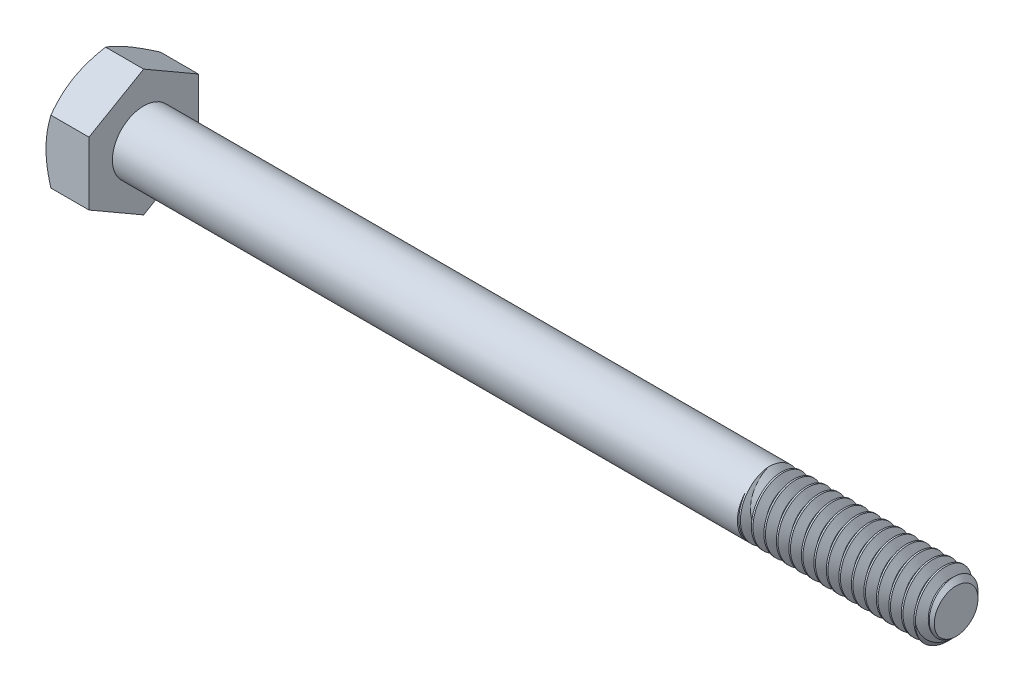
from build123d import *

# Parameters (mm, degrees)
SKETCH5_R           = 3.175
BOSS_EXTRUDE3_DEPTH = 82.55
CHAMFER1_SIZE       = 0.9525
CUT_SWEEP1_PITCH    = 1.27
BOSS_EXTRUDE4_DEPTH = 4.365625
SKETCH8_OUTSIDE_W   = 336.804
SKETCH8_OUTSIDE_H   = 338.524
SKETCH8_OUTSIDE_R   = 5.55625
CUT_EXTRUDE3_DEPTH  = 88.329034992
CUT_EXTRUDE3_DRAFT  = -60
CUT_EXTRUDE4_DEPTH  = 0.254
CIRPATTERN1_COUNT   = 3


with BuildPart() as part:
    # Sketch5 → Boss-Extrude3 (new body)
    with BuildSketch(Plane(origin=(43.4578125, 0, 0), x_dir=(0, 0, -1), z_dir=(1, 0, 0))):
        Circle(SKETCH5_R)
    extrude(amount=-BOSS_EXTRUDE3_DEPTH)

    # Chamfer1
    chamfer1_edges = [part.edges().sort_by_distance(p)[0] for p in [
        (43.4578125, 0, 3.175),
    ]]
    chamfer(chamfer1_edges, length=CHAMFER1_SIZE)

    # Cut-Sweep1: the profile of Sketch10 profile screwed along a right-hand helix of 16 turns, 8 arcs to a turn; built about Z, then put on its axis
    cut_sweep1_z = Axis((0, 0, 0), (0, 0, 1))
    cut_sweep1_corners = [(3.1753, 0, 0.000173205), (2.350110803, 0, -0.47625), (2.350110803, 0, -0.635), (3.1753, 0, -1.111423205)]
    with BuildLine(mode=Mode.PRIVATE) as cut_sweep1_profile:
        Line(cut_sweep1_corners[0], cut_sweep1_corners[1])
        Line(cut_sweep1_corners[1], cut_sweep1_corners[2])
        Line(cut_sweep1_corners[2], cut_sweep1_corners[3])
        Line(cut_sweep1_corners[3], cut_sweep1_corners[0])
    cut_sweep1_cap = Face(cut_sweep1_profile.wire())
    cut_sweep1_turn_angles = [0, 22.5, 45, 67.5, 90, 112.5, 135, 157.5, 180, 202.5, 225, 247.5, 270, 292.5, 315, 337.5, 360]
    cut_sweep1_turn_weights = [1, 0.9238795325112867, 1, 0.9238795325112867, 1, 0.9238795325112867, 1, 0.9238795325112867, 1, 0.9238795325112867, 1, 0.9238795325112867, 1, 0.9238795325112867, 1, 0.9238795325112867, 1]
    cut_sweep1_turn_rails = [Edge.make_bspline([Vector(p[0], p[1], 0).rotate(cut_sweep1_z, cut_sweep1_turn_angles[k]) / cut_sweep1_turn_weights[k] + Vector(0, 0, p[2] + CUT_SWEEP1_PITCH * cut_sweep1_turn_angles[k] / 360) for k in range(17)], [0, 0, 0, 1, 1, 2, 2, 3, 3, 4, 4, 5, 5, 6, 6, 7, 7, 8, 8, 8], 2, cut_sweep1_turn_weights) for p in cut_sweep1_corners]
    cut_sweep1_turn_sides = [Face.make_surface_from_curves(cut_sweep1_turn_rails[p[0]], cut_sweep1_turn_rails[p[1]]) for p in [(0, 1), (1, 2), (2, 3), (3, 0)]]
    cut_sweep1 = Plane(origin=(43.4578125, 0, 0), x_dir=(0, 1, 0), z_dir=(-1, 0, 0)) * Solid(Shell([*[p.moved(Location((0, 0, CUT_SWEEP1_PITCH * i))) for i in range(16) for p in cut_sweep1_turn_sides], cut_sweep1_cap, cut_sweep1_cap.rotate(cut_sweep1_z, 5760).moved(Location((0, 0, CUT_SWEEP1_PITCH * 5760 / 360)))]))
    add(cut_sweep1, mode=Mode.SUBTRACT)

    # Sketch11 → Revolve1 (revolve)
    with BuildSketch(Plane.XY, mode=Mode.PRIVATE) as revolve1_sk:
        Polygon((-39.0921875, 3.175), (-39.0921875, 0), (27.5828125, 0), (24.4078125, 3.175), align=None)
    revolve(revolve1_sk.sketch.rotate(Axis((-39.0921875, 0, 0), (1, 0, 0)), 270), axis=Axis((-39.0921875, 0, 0), (1, 0, 0)))

    # Sketch6 → Boss-Extrude4 (add)
    with BuildSketch(Plane.ZY.offset(39.0921875)):
        Polygon((5.55625, 3.207902433), (0, 6.415804866), (-5.55625, 3.207902433), (-5.55625, -3.207902433), (0, -6.415804866), (5.55625, -3.207902433), align=None)
    extrude(amount=BOSS_EXTRUDE4_DEPTH)


with BuildPart() as cut_extrude3_tool:
    # Sketch8 outside → Cut-Extrude3 (with draft: the straight prism first)
    with BuildSketch(Plane.ZY.offset(43.4578125)):
        Rectangle(SKETCH8_OUTSIDE_W, SKETCH8_OUTSIDE_H)
        Circle(SKETCH8_OUTSIDE_R, mode=Mode.SUBTRACT)
    extrude(amount=-CUT_EXTRUDE3_DEPTH)
    # Cut-Extrude3: the draft: its side faces are tilted about the plane it starts from
    cut_extrude3_sides = [cut_extrude3_tool.faces().sort_by_distance(p)[0] for p in [
        (0.706704996, -169.262, 0),
        (0.706704996, 0, 168.402),
        (0.706704996, 169.262, 0),
        (0.706704996, 0, -168.402),
        (0.706704996, 0, -5.55625),
    ]]
    draft(cut_extrude3_sides, Plane.ZY.offset(43.4578125), CUT_EXTRUDE3_DRAFT)


with BuildPart() as part_1:
    add(part.part)

    # Cut-Extrude3: cut by cut_extrude3_tool
    add(cut_extrude3_tool.part, mode=Mode.SUBTRACT)

    # Sketch12 → Cut-Extrude4 (cut)
    with BuildSketch(Plane.ZY.offset(43.4578125)):
        with BuildLine():
            Line((0.1666875, 4.2783125), (0.1666875, 2.3891875))
            ThreePointArc((0.1666875, 2.3891875), (0, 2.2225), (-0.1666875, 2.3891875))
            Line((-0.1666875, 2.3891875), (-0.1666875, 4.2783125))
            ThreePointArc((-0.1666875, 4.2783125), (0, 4.445), (0.1666875, 4.2783125))
        make_face()
    cut_extrude4 = extrude(amount=-CUT_EXTRUDE4_DEPTH, mode=Mode.SUBTRACT)

    # CirPattern1: Cut-Extrude4 ×3 about axis
    cirpattern1_axis = Axis((0, 0, 0), (1, 0, 0))
    for i in range(1, CIRPATTERN1_COUNT):
        add(cut_extrude4.rotate(cirpattern1_axis, i * 360 / CIRPATTERN1_COUNT), mode=Mode.SUBTRACT)


solid = part_1.part
